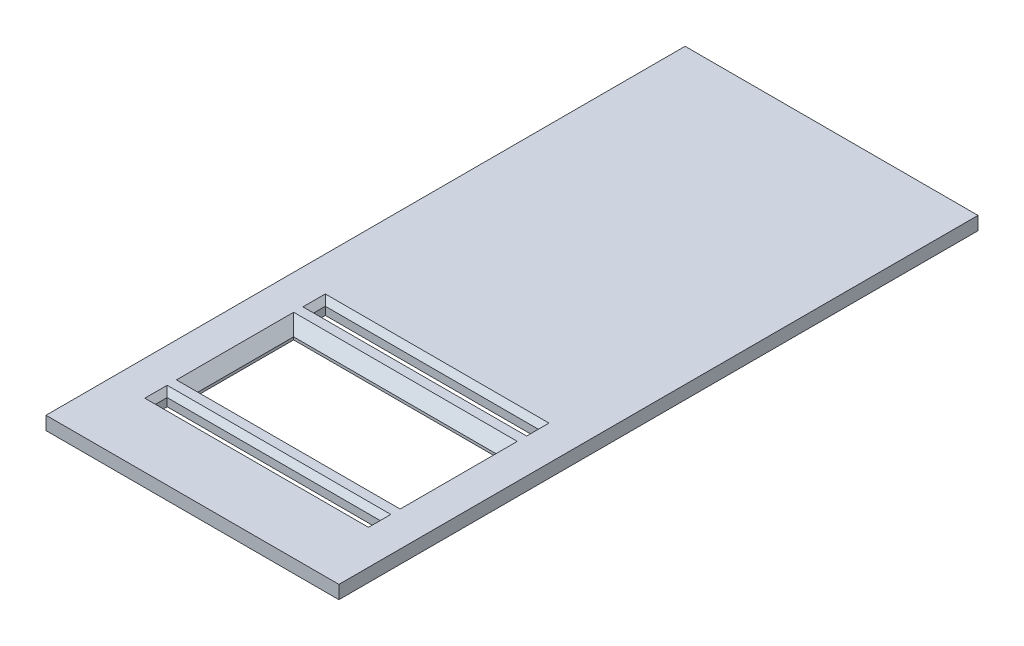
from build123d import *

# Parameters (mm, degrees)
SKETCH1_W           = 139.7
SKETCH1_H           = 304.8
BOSS_EXTRUDE1_DEPTH = 6.35
SKETCH2_W           = 96.52
SKETCH2_H           = 45.72
MAIN_HOLE_DEPTH     = 264.5058728
SKETCH3_W           = 101.6
SKETCH3_H           = 5.588
NEOPIXEL_DEPTH      = 264.5058728
CHAMFER1_SIZE       = 2.54
CHAMFER2_SIZE       = 5.08


with BuildPart() as part:
    # Sketch1 → Boss-Extrude1 (new body)
    with BuildSketch(Plane(origin=(0, 0, 0), x_dir=(1, 0, 0), z_dir=(0, 1, 0))):
        with Locations((0, 101.6)):
            Rectangle(SKETCH1_W, SKETCH1_H)
    extrude(amount=BOSS_EXTRUDE1_DEPTH)

    # Sketch2 → Main Hole (cut, through all)
    with BuildSketch(Plane(origin=(0, 6.35, 0), x_dir=(1, 0, 0), z_dir=(0, 1, 0))):
        with Locations((0, 22.86)):
            Rectangle(SKETCH2_W, SKETCH2_H)
    extrude(amount=-MAIN_HOLE_DEPTH, mode=Mode.SUBTRACT)

    # Sketch3 → NeoPixel (cut, through all)
    with BuildSketch(Plane(origin=(0, 6.35, 0), x_dir=(1, 0, 0), z_dir=(0, 1, 0))):
        with Locations((0, 60.579)):
            Rectangle(SKETCH3_W, SKETCH3_H)
    neopixel = extrude(amount=-NEOPIXEL_DEPTH, mode=Mode.SUBTRACT)

    # Mirror2: NeoPixel across plane
    add(neopixel.mirror(Plane.XY.offset(-22.86)), mode=Mode.SUBTRACT)

    # Chamfer1
    chamfer1_edges = [part.edges().sort_by_distance(p)[0] for p in [
        (50.8, 6.35, 14.859),
        (0, 6.35, 17.653),
        (-50.8, 6.35, 14.859),
        (0, 6.35, 12.065),
        (-50.8, 6.35, -60.579),
        (0, 6.35, -57.785),
        (50.8, 6.35, -60.579),
        (0, 6.35, -63.373),
    ]]
    chamfer(chamfer1_edges, length=CHAMFER1_SIZE)

    # Chamfer2
    chamfer2_edges = [part.edges().sort_by_distance(p)[0] for p in [
        (48.26, 6.35, -22.86),
        (0, 6.35, 0),
        (-48.26, 6.35, -22.86),
        (0, 6.35, -45.72),
    ]]
    chamfer(chamfer2_edges, length=CHAMFER2_SIZE)


solid = part.part
